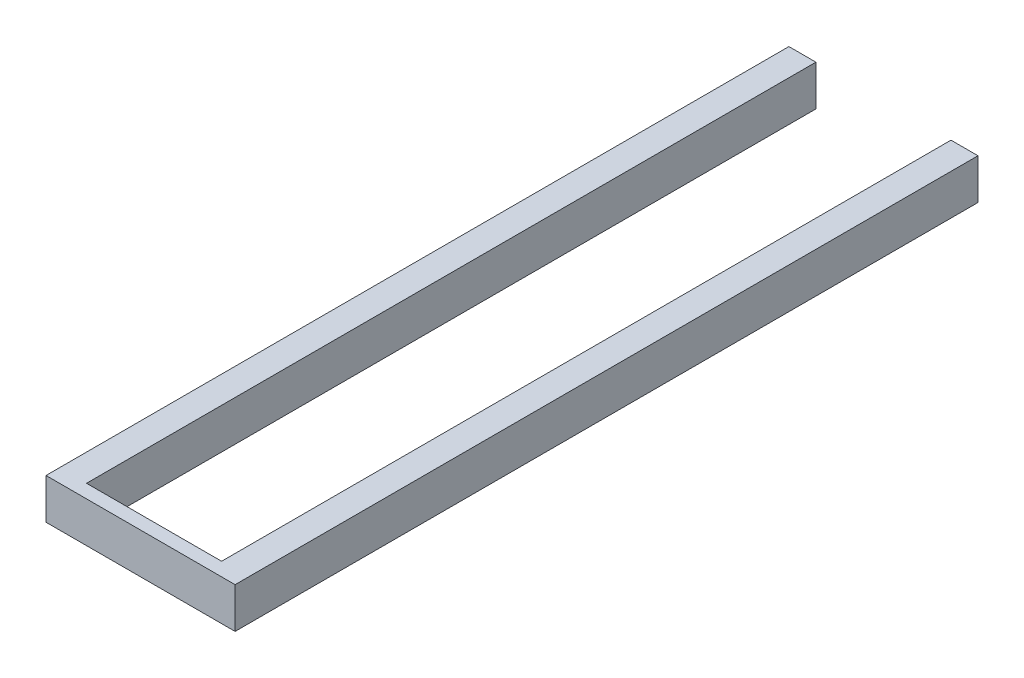
from build123d import *

# Parameters (mm, degrees)
BOSS_EXTRUDE1_DEPTH = 7.5


with BuildPart() as part:
    # Sketch1 → Boss-Extrude1 (new, symmetric)
    with BuildSketch(Plane(origin=(0, 0, 0), x_dir=(1, 0, 0), z_dir=(0, 1, 0))):
        Polygon((25, 135), (35, 135), (35, -140), (-35, -140), (-35, 135), (-25, 135), (-25, -135), (25, -135), align=None)
    extrude(amount=BOSS_EXTRUDE1_DEPTH, both=True)


solid = part.part
